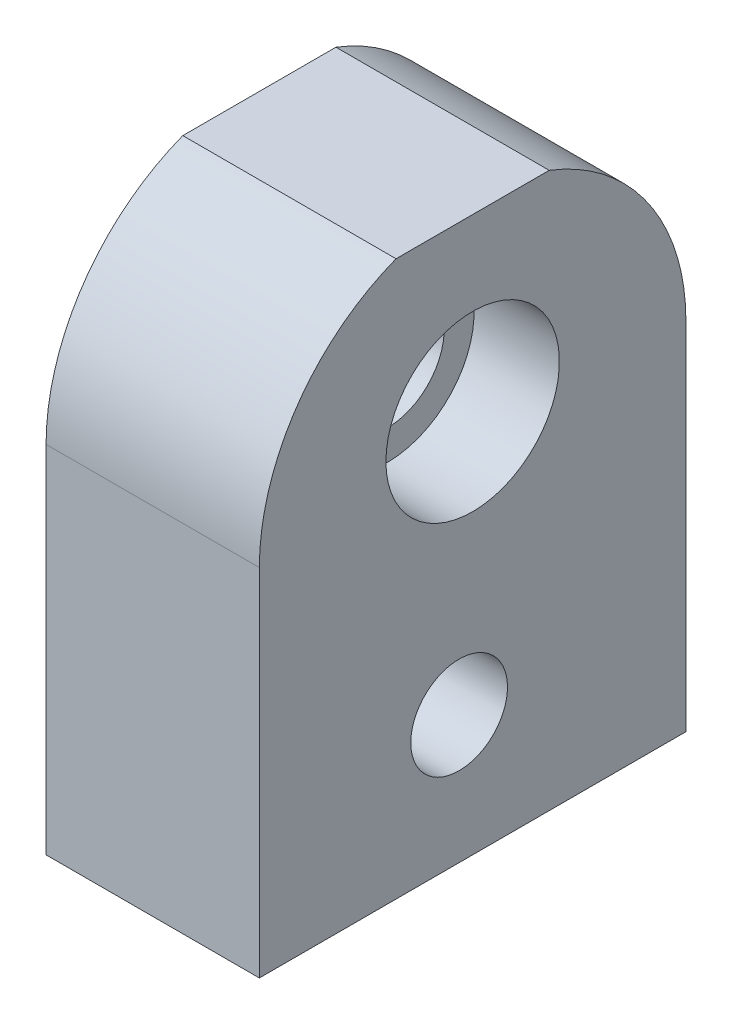
from build123d import *

# Parameters (mm, degrees)
SKETCH_1_W               = 15
SKETCH_1_H               = 30
EXTRUDE_1_DEPTH          = 25
EXTRUDE_3_DEPTH          = 15
SKETCH_4_R               = 1.65
CUT_EXTRUDE_2_DEPTH      = 10
SKETCH_9_R               = 6.1
CUT_EXTRUDE_3_DEPTH      = 6
SKETCH_10_R              = 4
CUT_EXTRUDE_4_DEPTH      = 51.803543184
CUT_EXTRUDE_6_DEPTH      = 53.201532545
CUT_EXTRUDE_6_DEPTH_BACK = 53.201532545
SKETCH_5_R               = 3.4
CUT_EXTRUDE_8_DEPTH      = 52.439284598


with BuildPart() as part:
    # 草图1 → 凸台-拉伸1 (new body)
    with BuildSketch(Plane(origin=(0, 0, 0), x_dir=(1, 0, 0), z_dir=(0, 1, 0))):
        with Locations((7.5, -15)):
            Rectangle(SKETCH_1_W, SKETCH_1_H)
    extrude(amount=EXTRUDE_1_DEPTH)

    # 草图3 → 凸台-拉伸3 (add)
    with BuildSketch(Plane.ZY):
        with BuildLine():
            ThreePointArc((30, 25), (15, 40), (0, 25))
            Line((0, 25), (30, 25))
        make_face()
    extrude(amount=-EXTRUDE_3_DEPTH)

    # 草图4 → 切除-拉伸2 (cut)
    with BuildSketch(Plane.XZ):
        with Locations((7.5, 24)):
            Circle(SKETCH_4_R)
        with Locations((7.5, 6)):
            Circle(SKETCH_4_R)
    extrude(amount=-CUT_EXTRUDE_2_DEPTH, mode=Mode.SUBTRACT)

    # 草图9 → 切除-拉伸3 (cut)
    with BuildSketch(Plane.ZY):
        with Locations((15, 27)):
            Circle(SKETCH_9_R)
    extrude(amount=-CUT_EXTRUDE_3_DEPTH, mode=Mode.SUBTRACT)

    # 草图10 → 切除-拉伸4 (cut, through all)
    with BuildSketch(Plane.ZY.offset(-6)):
        with Locations((15, 27)):
            Circle(SKETCH_10_R)
    extrude(amount=-CUT_EXTRUDE_4_DEPTH, mode=Mode.SUBTRACT)


with BuildPart() as body_2:
    # 镜向1: mirrored copy
    add(part.part.mirror(Plane(origin=(0, 0, 0), x_dir=(0, 0, 1), z_dir=(1, 0, 0))))

    # 草图12 → 切除-拉伸6 (cut, two sides: drawn at the far end of the back side and taken through both)
    with BuildSketch(Plane(origin=(0, 0, 0), x_dir=(0, 0, -1), z_dir=(1, 0, 0)).offset(-CUT_EXTRUDE_6_DEPTH_BACK)):
        with BuildLine():
            ThreePointArc((-9.614835193, 39), (-15, 40), (-20.385164807, 39))
            Line((-20.385164807, 39), (-9.614835193, 39))
        make_face()
    extrude(amount=CUT_EXTRUDE_6_DEPTH + CUT_EXTRUDE_6_DEPTH_BACK, mode=Mode.SUBTRACT)

    # 草图5 → 切除-拉伸8 (cut, through all)
    with BuildSketch(Plane.ZY):
        with Locations((15.95, 9)):
            Circle(SKETCH_5_R)
    extrude(amount=CUT_EXTRUDE_8_DEPTH, mode=Mode.SUBTRACT)


solid = body_2.part
